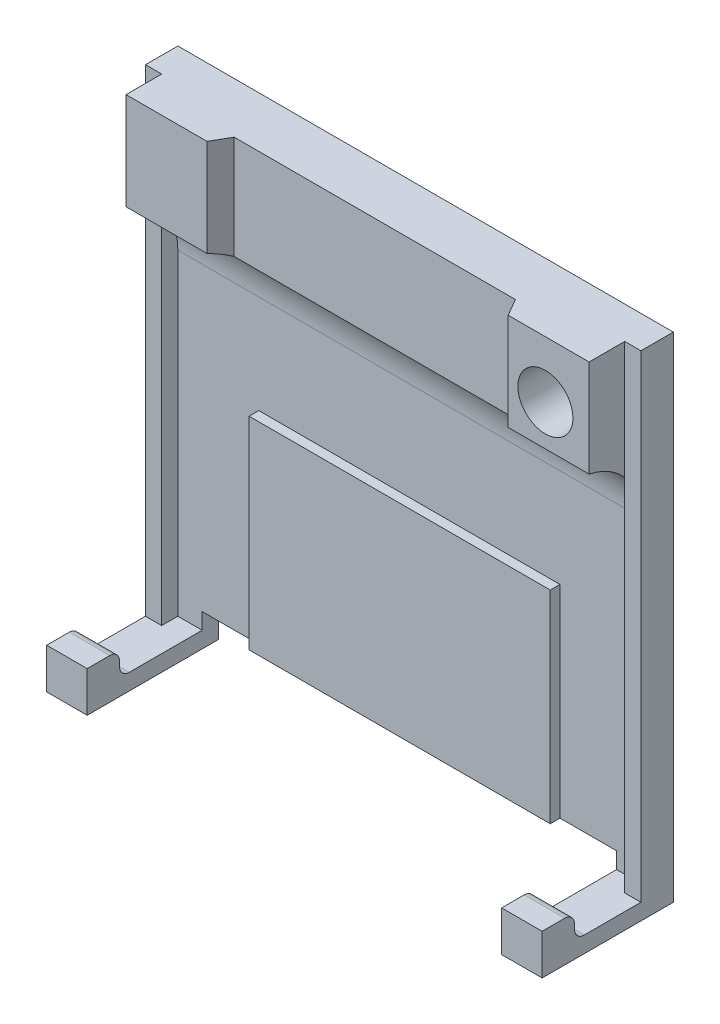
from build123d import *

# Parameters (mm, degrees)
ESQUISSE1_W             = 28.6
ESQUISSE1_H             = 16.5
BOSS_EXTRU_1_DEPTH      = 1
ESQUISSE2_W             = 18.6
ESQUISSE2_H             = 12.5
BOSS_EXTRU_2_DEPTH      = 0.6
ESQUISSE3_W             = 28.6
ESQUISSE3_H             = 12
BOSS_EXTRU_3_DEPTH      = 1
ESQUISSE4_W             = 28.6
ESQUISSE4_H             = 6
BOSS_EXTRU_4_DEPTH      = 3.2
ESQUISSE5_R             = 1.7
ENL_V_MAT_EXTRU_1_DEPTH = 26.143438508
CONG_1_R                = 4
ESQUISSE6_W             = 1.5
ESQUISSE6_H             = 1
BOSS_EXTRU_5_DEPTH      = 2
ESQUISSE7_W             = 2.5
ESQUISSE7_H             = 1
BOSS_EXTRU_6_DEPTH      = 7.1
ESQUISSE8_W             = 2.5
ESQUISSE8_H             = 2
BOSS_EXTRU_7_DEPTH      = 1.5
CONG_2_R                = 0.6
ESQUISSE9_W             = 1
ESQUISSE9_H             = 30.5
BOSS_EXTRU_8_DEPTH      = 2
CHANFREIN2_SIZE         = 1
ENL_V_MAT_EXTRU_2_DEPTH = 10


with BuildPart() as part:
    # Esquisse1 → Boss.-Extru.1 (new body)
    with BuildSketch(Plane.XY):
        Rectangle(ESQUISSE1_W, ESQUISSE1_H)
    extrude(amount=BOSS_EXTRU_1_DEPTH)

    # Esquisse2 → Boss.-Extru.2 (add)
    with BuildSketch(Plane.XY.offset(1)):
        with Locations((0, -2)):
            Rectangle(ESQUISSE2_W, ESQUISSE2_H)
    extrude(amount=BOSS_EXTRU_2_DEPTH)

    # Esquisse3 → Boss.-Extru.3 (add)
    with BuildSketch(Plane(origin=(0, 0, 0), x_dir=(-1, 0, 0), z_dir=(0, 0, -1))):
        with Locations((0, 14.25)):
            Rectangle(ESQUISSE3_W, ESQUISSE3_H)
    extrude(amount=-BOSS_EXTRU_3_DEPTH)

    # Esquisse4 → Boss.-Extru.4 (add)
    with BuildSketch(Plane.XY.offset(1)):
        with Locations((0, 17.25)):
            Rectangle(ESQUISSE4_W, ESQUISSE4_H)
    extrude(amount=BOSS_EXTRU_4_DEPTH)

    # Esquisse5 → Enlèv. mat.-Extru.1 (cut, through all)
    with BuildSketch(Plane(origin=(0, 0, 0), x_dir=(-1, 0, 0), z_dir=(0, 0, -1))):
        with Locations((-11.6, 16.75)):
            Circle(ESQUISSE5_R)
    extrude(amount=-ENL_V_MAT_EXTRU_1_DEPTH, mode=Mode.SUBTRACT)

    # Congé1
    # the kernel refuses this fillet: 4 mm, written as the material it adds along each edge
    with BuildSketch(Plane(origin=(14.3, 14.25, 1), x_dir=(0, -1, 0), z_dir=(-1, 0, 0))) as cong_1_piece_1:
        with BuildLine():
            CenterArc((3.919183588, 4), CONG_1_R, 191.536959033, 78.463040967)
            Line((0, 3.2), (-0.078383672, 3.184))
            ThreePointArc((-0.078383672, 3.184), (-0.08, 1.6), (-0.08, 0))
            Line((-0.08, 0), (0, -0.08))
            Line((0, -0.08), (3.919183588, -0.08))
            Line((3.919183588, -0.08), (3.919183588, 0))
        make_face()
    extrude(amount=28.6)

    # Esquisse6 → Boss.-Extru.5 (add)
    with BuildSketch(Plane.XZ.offset(8.25)):
        with Locations((-13.55, 0.5)):
            Rectangle(ESQUISSE6_W, ESQUISSE6_H)
        with Locations((13.55, 0.5)):
            Rectangle(ESQUISSE6_W, ESQUISSE6_H)
    extrude(amount=BOSS_EXTRU_5_DEPTH)

    # Esquisse7 → Boss.-Extru.6 (add)
    with BuildSketch(Plane.XY.offset(1)):
        with Locations((-14.05, -9.75)):
            Rectangle(ESQUISSE7_W, ESQUISSE7_H)
        with Locations((14.05, -9.75)):
            Rectangle(ESQUISSE7_W, ESQUISSE7_H)
    extrude(amount=BOSS_EXTRU_6_DEPTH)

    # Esquisse8 → Boss.-Extru.7 (add)
    with BuildSketch(Plane(origin=(0, -9.25, 0), x_dir=(1, 0, 0), z_dir=(0, 1, 0))):
        with Locations((-14.05, -7.1)):
            Rectangle(ESQUISSE8_W, ESQUISSE8_H)
        with Locations((14.05, -7.1)):
            Rectangle(ESQUISSE8_W, ESQUISSE8_H)
    extrude(amount=BOSS_EXTRU_7_DEPTH)

    # Congé2
    cong_2_edges = [part.edges().sort_by_distance(p)[0] for p in [
        (-14.05, -9.25, 6.1),
        (-14.05, -7.75, 6.1),
        (14.05, -9.25, 6.1),
        (14.05, -7.75, 6.1),
    ]]
    fillet(cong_2_edges, radius=CONG_2_R)

    # Esquisse9 → Boss.-Extru.8 (add)
    with BuildSketch(Plane(origin=(0, 0, 0), x_dir=(-1, 0, 0), z_dir=(0, 0, -1))):
        with Locations((-14.8, 5)):
            Rectangle(ESQUISSE9_W, ESQUISSE9_H)
        with Locations((14.8, 5)):
            Rectangle(ESQUISSE9_W, ESQUISSE9_H)
    extrude(amount=-BOSS_EXTRU_8_DEPTH)

    # Chanfrein2
    chanfrein2_edges = [part.edges().sort_by_distance(p)[0] for p in [
        (13.3, 16.75, 0),
    ]]
    chamfer(chanfrein2_edges, length=CHANFREIN2_SIZE)

    # Esquisse10 → Enlèv. mat.-Extru.2 (cut)
    with BuildSketch(Plane(origin=(0, 20.25, 0), x_dir=(1, 0, 0), z_dir=(0, 1, 0))):
        Polygon((9.3, -4.2), (8.685937971, -3.136413366), (-8.685937971, -3.136413366), (-9.3, -4.2), align=None)
    extrude(amount=-ENL_V_MAT_EXTRU_2_DEPTH, mode=Mode.SUBTRACT)


solid = part.part
